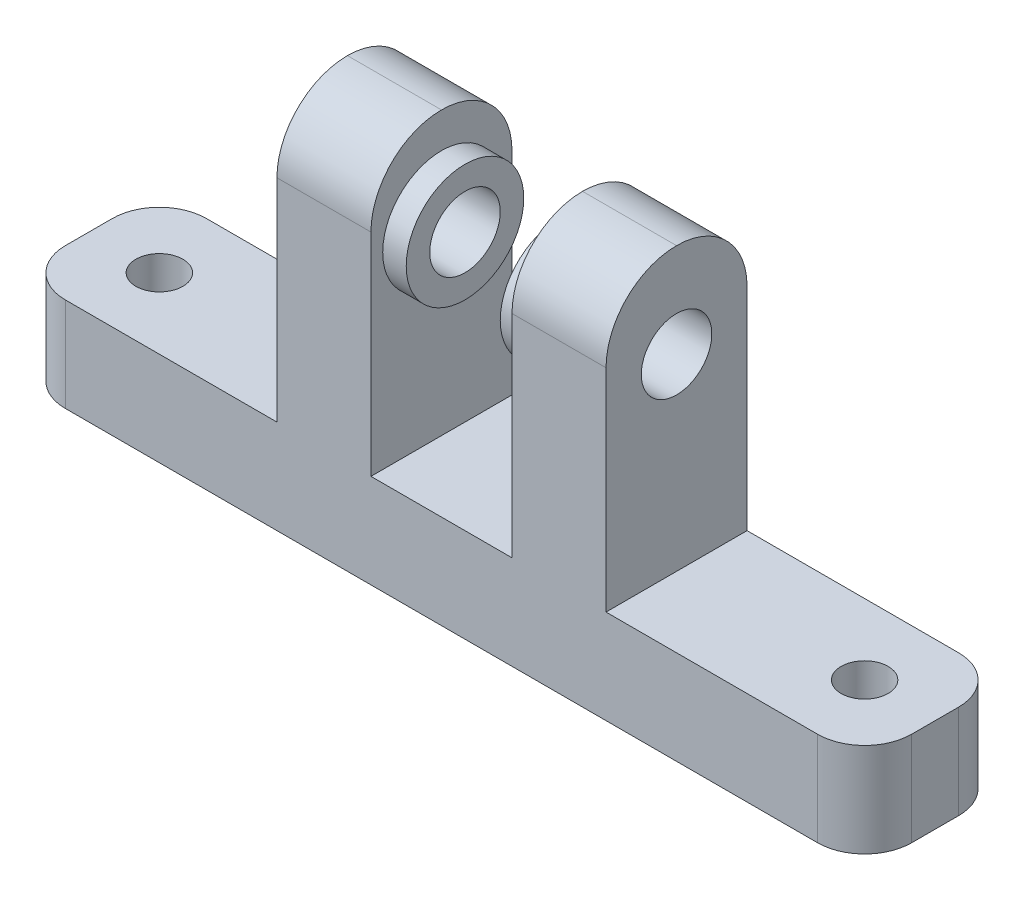
from build123d import *
from build123d.topology import SkipClean

# Parameters (mm, degrees)
SKETCH2_W               = 14
SKETCH2_H               = 6
BOSS_EXTRUDE1_DEPTH     = 4
SKETCH3_W               = 4
SKETCH3_H               = 6
BOSS_EXTRUDE2_DEPTH     = 12
CUT_EXTRUDE1_DEPTH      = 22.470910554
CUT_EXTRUDE1_DEPTH_BACK = 22.470910554
SKETCH4_R               = 1.5
BOSS_EXTRUDE3_START     = 1
SKETCH5_R               = 2.5
SKETCH5_R_2             = 1.5
BOSS_EXTRUDE3_DEPTH     = 1
SKETCH6_R               = 2.5
SKETCH6_R_2             = 1.5
BOSS_EXTRUDE4_DEPTH     = 1
SKETCH7_W               = 11
SKETCH7_H               = 6
SKETCH7_R               = 1
BOSS_EXTRUDE5_DEPTH     = 4
FILLET1_R               = 2
FILLET2_R               = 3


with BuildPart() as part:
    # Sketch2 → Boss-Extrude1 (new body)
    with BuildSketch(Plane(origin=(0, 0, 0), x_dir=(1, 0, 0), z_dir=(0, 1, 0))):
        Rectangle(SKETCH2_W, SKETCH2_H)
    extrude(amount=BOSS_EXTRUDE1_DEPTH)

    # Sketch3 → Boss-Extrude2 (add)
    with BuildSketch(Plane(origin=(0, 4, 0), x_dir=(1, 0, 0), z_dir=(0, 1, 0))):
        with Locations((-5, 0)):
            Rectangle(SKETCH3_W, SKETCH3_H)
        with Locations((5, 0)):
            Rectangle(SKETCH3_W, SKETCH3_H)
    extrude(amount=BOSS_EXTRUDE2_DEPTH)

    # Sketch4 → Cut-Extrude1 (cut, two sides: drawn at the far end of the back side and taken through both)
    with BuildSketch(Plane(origin=(7, 0, 0), x_dir=(0, 0, -1), z_dir=(1, 0, 0)).offset(-CUT_EXTRUDE1_DEPTH_BACK)):
        with Locations((0, 12)):
            Circle(SKETCH4_R)
    extrude(amount=CUT_EXTRUDE1_DEPTH + CUT_EXTRUDE1_DEPTH_BACK, mode=Mode.SUBTRACT)

    # Sketch5 → Boss-Extrude3 (add)
    with BuildSketch(Plane(origin=(-3, 0, 0), x_dir=(0, 0, -1), z_dir=(1, 0, 0)).offset(BOSS_EXTRUDE3_START)):
        with Locations(Location((0, 12, 0), (0, 0, 180))):
            Circle(SKETCH5_R)
        with Locations((0, 12)):
            Circle(SKETCH5_R_2, mode=Mode.SUBTRACT)
    extrude(amount=-BOSS_EXTRUDE3_DEPTH)

    # Sketch6 → Boss-Extrude4 (add)
    with SkipClean():  # the faces are left unmerged after this step: merging them gives an invalid solid
        with BuildSketch(Plane.ZY.offset(-3)):
            with Locations((0, 12)):
                Circle(SKETCH6_R)
            with Locations((0, 12)):
                Circle(SKETCH6_R_2, mode=Mode.SUBTRACT)
        extrude(amount=BOSS_EXTRUDE4_DEPTH)

    # Sketch7 → Boss-Extrude5 (add)
    # profile 1 of 2: a face of its own
    with SkipClean():  # the faces are left unmerged after this step: merging them gives an invalid solid
        with BuildSketch(Plane(origin=(0, 4, 0), x_dir=(1, 0, 0), z_dir=(0, 1, 0))):
            with Locations((12.5, 0)):
                Rectangle(SKETCH7_W, SKETCH7_H)
            with Locations(Location((15, 0, 0), (0, 0, 270))):
                Circle(SKETCH7_R, mode=Mode.SUBTRACT)
        # profile 2 of 2: a face of its own
        with BuildSketch(Plane(origin=(0, 4, 0), x_dir=(1, 0, 0), z_dir=(0, 1, 0))):
            with Locations((-12.5, 0)):
                Rectangle(SKETCH7_W, SKETCH7_H)
            with Locations(Location((-15, 0, 0), (0, 0, 270))):
                Circle(SKETCH7_R, mode=Mode.SUBTRACT)
        extrude(amount=-BOSS_EXTRUDE5_DEPTH)

    # Fillet1
    fillet1_edges = [part.edges().sort_by_distance(p)[0] for p in [
        (18, 2, -3),
        (18, 2, 3),
        (-18, 2, 3),
        (-18, 2, -3),
    ]]
    fillet(fillet1_edges, radius=FILLET1_R)

    # Fillet2
    fillet2_edges = [part.edges().sort_by_distance(p)[0] for p in [
        (-5, 16, -3),
        (5, 16, -3),
        (5, 16, 3),
        (-5, 16, 3),
    ]]
    fillet(fillet2_edges, radius=FILLET2_R - 0.0001)  # a hair under: the kernel refuses the full size


solid = part.part
